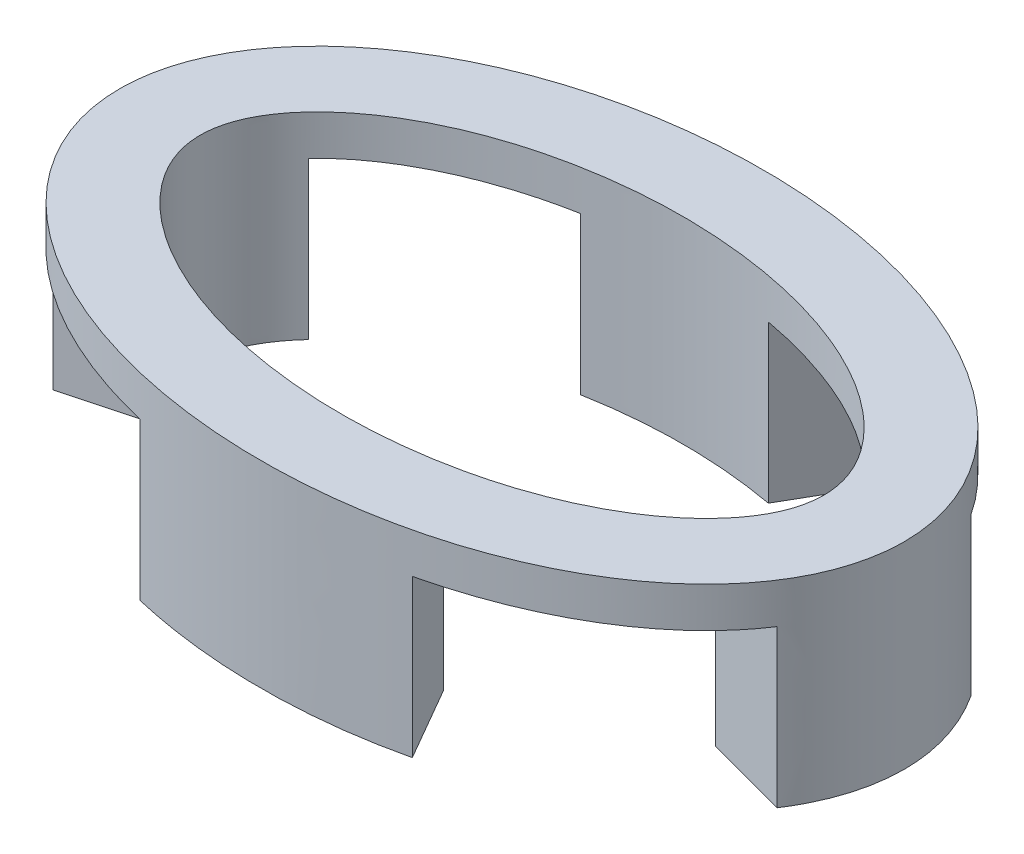
from build123d import *

# Parameters (mm, degrees)
SKETCH2_RX           = 97.5
SKETCH2_RY           = 62.5
BOSS_EXTRUDE1_DEPTH  = 3
CUT_EXTRUDE1_DEPTH   = 4
CHAMFER2_SIZE        = 1
BOSS_EXTRUDE2_DEPTH  = 49
SKETCH5_RX           = 97.5
SKETCH5_RY           = 62.5
CUT_EXTRUDE2_DEPTH   = 6
CUT_EXTRUDE3_DEPTH   = 39
MIRROR2_COPY_1_DEPTH = 39


with BuildPart() as part:
    # Sketch2 → Boss-Extrude1 (new, symmetric)
    with BuildSketch(Plane(origin=(0, 0, 0), x_dir=(1, 0, 0), z_dir=(0, 1, 0))):
        with Locations((0, 0)):
            Ellipse(SKETCH2_RX, SKETCH2_RY)
    extrude(amount=BOSS_EXTRUDE1_DEPTH, both=True)

    # Sketch3 → Cut-Extrude1 (cut)
    with BuildSketch(Plane(origin=(0, 3, 0), x_dir=(1, 0, 0), z_dir=(0, 1, 0))):
        Polygon((-34.199999999999996, 22.2), (34.20000000000001, 22.2), (34.20000000000001, -22.2), (-34.19999999999999, -22.2), align=None)
    extrude(amount=-CUT_EXTRUDE1_DEPTH, mode=Mode.SUBTRACT)

    # Chamfer2
    chamfer2_edges = [part.edges().sort_by_distance(p)[0] for p in [
        (7.11e-15, 3, 22.2),
        (34.20000000000001, 3, 0),
        (7.11e-15, 3, -22.2),
        (-34.19999999999999, 3, 0),
    ]]
    chamfer(chamfer2_edges, length=CHAMFER2_SIZE)

    # Boss-Extrude2: read off the stored shape, not the designer's step
    # Boss-Extrude2 outline → Boss-Extrude2 (add)
    with BuildSketch(Plane.XZ.offset(3)):
        with BuildLine():
            add(Edge.make_bspline(
                [(97.5, 0), (97.5, 108.2531754730548), (-48.74999999999998, 54.12658773652742), (-194.99999999999994, 1.531e-14), (-48.75000000000004, -54.1265877365274), (97.49999999999984, -108.25317547305485), (97.5, 0)],
                knots=[0, 0, 0, 2.0943951023931953, 2.0943951023931953, 4.1887902047863905, 4.1887902047863905, 6.283185307179586, 6.283185307179586, 6.283185307179586], degree=2, weights=[1, 0.5000000000000001, 1, 0.5000000000000001, 1, 0.5000000000000001, 1]))
        make_face()
        with BuildLine():
            add(Edge.make_bspline(
                [(77.5, 0), (77.5, 2.05153029392787), (76.896839649338, 6.15459088178361), (73.7614064019966, 12.9769434983319), (67.7379482689495, 20.3167028975504), (58.621429311724, 27.5010369489446), (46.6738677118328, 33.8186955759619), (27.7018251632302, 40.3508722503388), (0, 43.9327518331075), (-27.7018251632302, 40.3508722503388), (-46.6738677118328, 33.8186955759619), (-58.621429311724, 27.5010369489445), (-67.7379482689496, 20.3167028975504), (-73.7614064019966, 12.9769434983319), (-76.896839649338, 6.15459088178362), (-77.801580175331, 0), (-76.896839649338, -6.15459088178361), (-73.7614064019966, -12.9769434983319), (-67.7379482689496, -20.3167028975503), (-58.6214293117241, -27.5010369489446), (-46.6738677118328, -33.8186955759618), (-27.7018251632302, -40.3508722503388), (0, -43.9327518331075), (27.7018251632302, -40.3508722503388), (46.6738677118328, -33.8186955759619), (58.621429311724, -27.5010369489446), (67.7379482689495, -20.3167028975504), (73.7614064019966, -12.9769434983319), (76.8968396493379, -6.15459088178363), (77.5, -2.05153029392788), (77.5, 0)],
                knots=[0, 0, 0, 0, 0.196349540849362, 0.392699081698724, 0.589048622548086, 0.785398163397448, 0.98174770424681, 1.17809724509617, 1.5707963267949, 1.96349540849362, 2.15984494934298, 2.35619449019234, 2.55254403104171, 2.74889357189107, 2.94524311274043, 3.14159265358979, 3.33794219443916, 3.53429173528852, 3.73064127613788, 3.92699081698724, 4.1233403578366, 4.31968989868597, 4.71238898038469, 5.10508806208341, 5.30143760293278, 5.49778714378214, 5.6941366846315, 5.89048622548086, 6.08683576633022, 6.28318530717959, 6.28318530717959, 6.28318530717959, 6.28318530717959], degree=3))
        make_face(mode=Mode.SUBTRACT)
    extrude(amount=BOSS_EXTRUDE2_DEPTH)

    # Sketch5 → Cut-Extrude2 (cut)
    with BuildSketch(Plane(origin=(0, 3, 0), x_dir=(1, 0, 0), z_dir=(0, 1, 0))):
        with Locations((0, 0)):
            Ellipse(SKETCH5_RX, SKETCH5_RY)
    extrude(amount=-CUT_EXTRUDE2_DEPTH, mode=Mode.SUBTRACT)

    # Sketch9 → Cut-Extrude3 (cut)
    with BuildSketch(Plane.XZ.offset(52.00000000000001)):
        Polygon((33.841113199180676, 58.614527445670475), (16.920556599590334, 29.307263722835227), (54.665477409183175, 14.647570525652423), (119.98220877654252, 32.14913594777695), (33.841113199180676, 65.60534689609572), align=None)
    cut_extrude3 = extrude(amount=-CUT_EXTRUDE3_DEPTH, mode=Mode.SUBTRACT)

    # Mirror1: Cut-Extrude3 across plane
    add(cut_extrude3.mirror(Plane(origin=(0, 0, 0), x_dir=(0, 0, 1), z_dir=(1, 0, 0))), mode=Mode.SUBTRACT)

    # Mirror2: Cut-Extrude3 across plane
    add(cut_extrude3.mirror(Plane.XY), mode=Mode.SUBTRACT)

    # Mirror2 copy 1 sketch → Mirror2 copy 1 (cut)
    with BuildSketch(Plane(origin=(0, -52.00000000000001, 0), x_dir=(-1, 0, 0), z_dir=(0, -1, 0))):
        Polygon((33.841113199180676, 58.614527445670475), (16.920556599590334, 29.307263722835227), (54.665477409183175, 14.647570525652423), (119.98220877654252, 32.14913594777695), (33.841113199180676, 65.60534689609572), align=None)
    extrude(amount=-MIRROR2_COPY_1_DEPTH, mode=Mode.SUBTRACT)


solid = part.part
